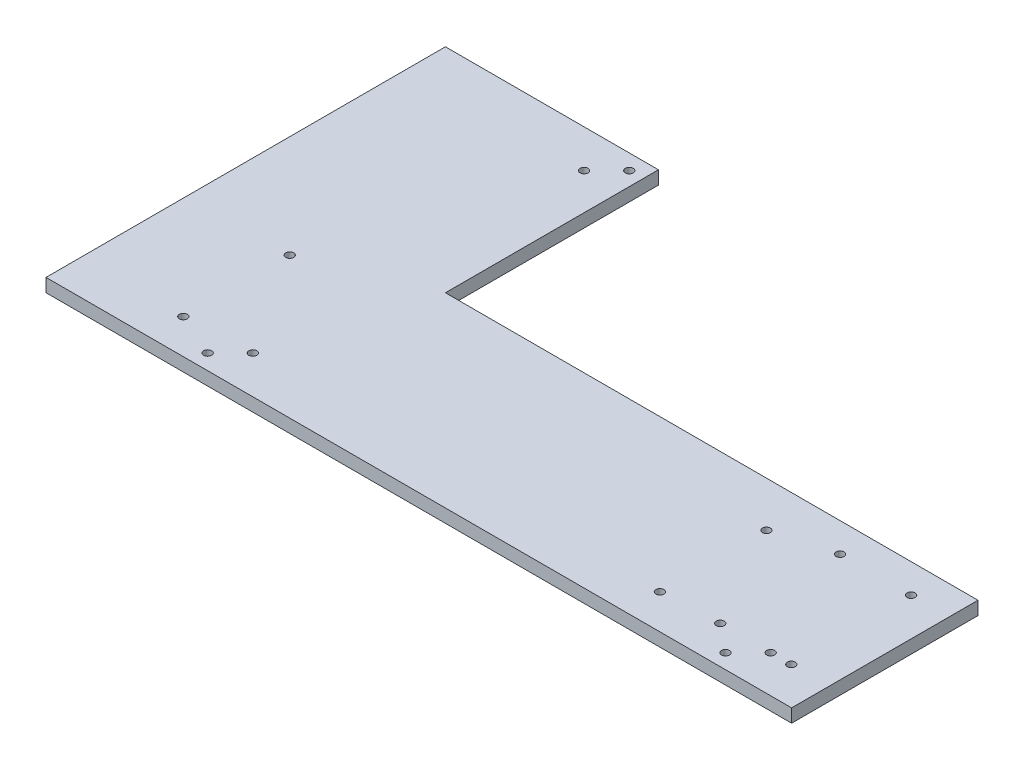
from build123d import *

# Parameters (mm, degrees)
SKETCH1_R           = 1.5
BOSS_EXTRUDE1_DEPTH = 5


with BuildPart() as part:
    # Sketch1 → Boss-Extrude1 (new body)
    with BuildSketch(Plane(origin=(0, 0, 0), x_dir=(1, 0, 0), z_dir=(0, 1, 0))):
        Polygon((-124.555160142, -60.782918149), (155.444839858, -60.782918149), (155.444839858, 9.217081851), (-44.555160142, 9.217081851), (-44.555160142, 89.217081851), (-124.555160142, 89.217081851), align=None)
        with Locations((-69.609979708, -55.025558837)):
            Circle(SKETCH1_R, mode=Mode.SUBTRACT)
        with Locations((-86.021964222, -47.738383023)):
            Circle(SKETCH1_R, mode=Mode.SUBTRACT)
        with Locations((-61.124698334, -46.540277462)):
            Circle(SKETCH1_R, mode=Mode.SUBTRACT)
        with Locations((-86.021964222, -7.782918149)):
            Circle(SKETCH1_R, mode=Mode.SUBTRACT)
        with Locations((92.978035778, -47.782918149)):
            Circle(SKETCH1_R, mode=Mode.SUBTRACT)
        with Locations((114.56536262, -46.697186586)):
            Circle(SKETCH1_R, mode=Mode.SUBTRACT)
        with Locations((125.096363889, -55.261198979)):
            Circle(SKETCH1_R, mode=Mode.SUBTRACT)
        with Locations((133.581645264, -46.775917605)):
            Circle(SKETCH1_R, mode=Mode.SUBTRACT)
        with Locations((141.245237107, -46.697186586)):
            Circle(SKETCH1_R, mode=Mode.SUBTRACT)
        with Locations((92.978035778, -7.782918149)):
            Circle(SKETCH1_R, mode=Mode.SUBTRACT)
        with Locations((114.56536262, -1.697186586)):
            Circle(SKETCH1_R, mode=Mode.SUBTRACT)
        with Locations((141.245237107, -1.697186586)):
            Circle(SKETCH1_R, mode=Mode.SUBTRACT)
        with Locations((-49.752255096, 83.459722538)):
            Circle(SKETCH1_R, mode=Mode.SUBTRACT)
        with Locations((-58.23753647, 74.974441163)):
            Circle(SKETCH1_R, mode=Mode.SUBTRACT)
    extrude(amount=BOSS_EXTRUDE1_DEPTH)


solid = part.part
